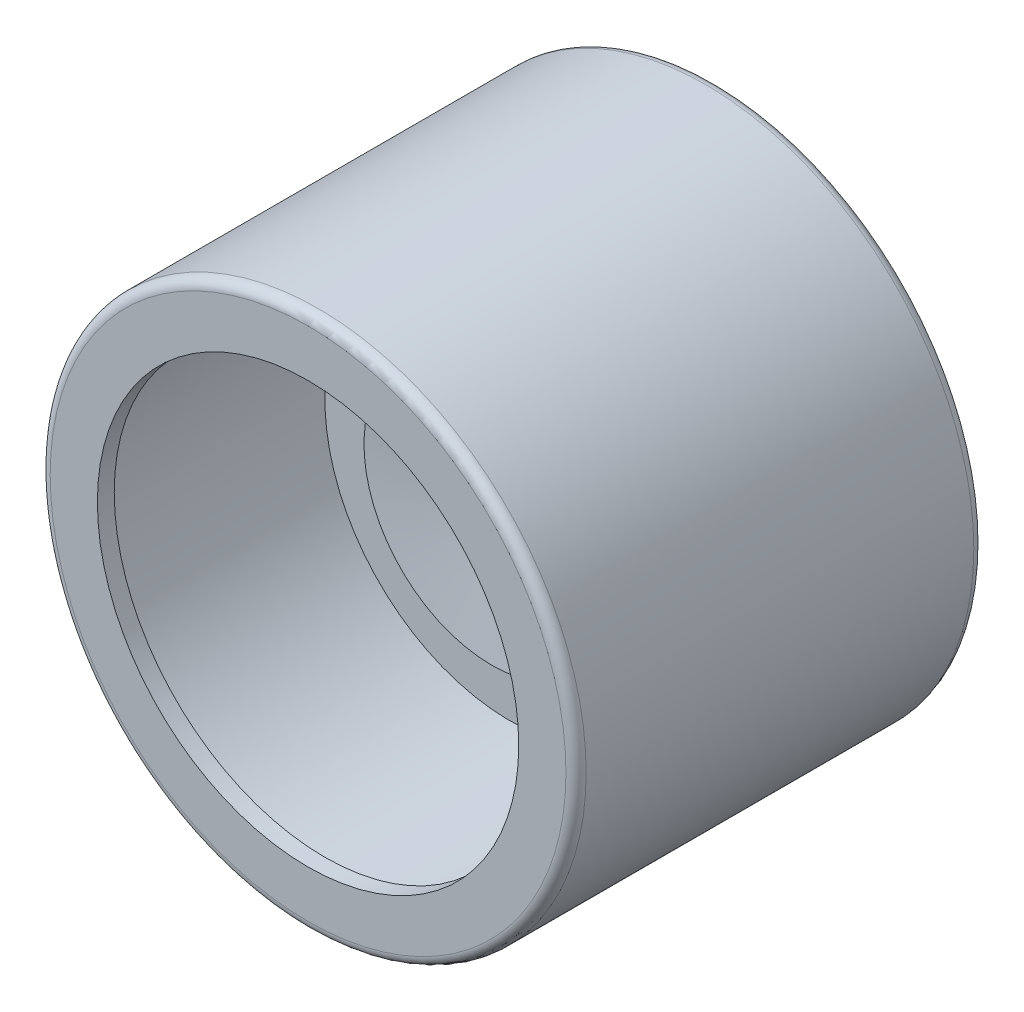
from build123d import *

# Parameters (mm, degrees)
SKETCH1_R           = 7.95
BOSS_EXTRUDE1_DEPTH = 12.1
FILLET1_R           = 0.3
SKETCH3_R           = 7.5
CUT_EXTRUDE2_DEPTH  = 10
SKETCH2_R           = 7.65
SKETCH2_R_2         = 6.25
BOSS_EXTRUDE2_DEPTH = 0.5
SKETCH4_R           = 5.5
BOSS_EXTRUDE3_DEPTH = 4


with BuildPart() as part:
    # Sketch1 → Boss-Extrude1 (new body)
    with BuildSketch(Plane.XY):
        Circle(SKETCH1_R)
    extrude(amount=BOSS_EXTRUDE1_DEPTH)

    # Fillet1
    fillet1_edges = [part.edges().sort_by_distance(p)[0] for p in [
        (-7.95, 0, 0),
        (-7.95, 0, 12.1),
    ]]
    fillet(fillet1_edges, radius=FILLET1_R)

    # Sketch3 → Cut-Extrude2 (cut)
    with BuildSketch(Plane.XY.offset(12.1)):
        Circle(SKETCH3_R)
    extrude(amount=-CUT_EXTRUDE2_DEPTH, mode=Mode.SUBTRACT)

    # Sketch2 → Boss-Extrude2 (add)
    with BuildSketch(Plane.XY.offset(12.1)):
        Circle(SKETCH2_R)
        Circle(SKETCH2_R_2, mode=Mode.SUBTRACT)
    extrude(amount=-BOSS_EXTRUDE2_DEPTH)

    # Sketch4 → Boss-Extrude3 (add)
    with BuildSketch(Plane.XY.offset(2.1)):
        Circle(SKETCH4_R)
    extrude(amount=BOSS_EXTRUDE3_DEPTH)

    # Sketch6 → Revolve2 (revolve)
    with BuildSketch(Plane(origin=(0, 0, 0), x_dir=(0, 0, -1), z_dir=(1, 0, 0))):
        with BuildLine():
            Line((-5.5, 3.790901005), (-5.5, 0))
            Line((-5.5, 0), (-6, 0))
            Line((-6, 0), (-6, 0.25))
            Line((-6, 0.25), (-6.119453289, 0.451240685))
            ThreePointArc((-6.119453289, 0.451240685), (-6.249755753, 0.734093475), (-6.318842572, 1.03775685))
            Line((-6.318842572, 1.03775685), (-6.65, 3.790901005))
            Line((-6.65, 3.790901005), (-5.5, 3.790901005))
        make_face()
    revolve(axis=Axis((0, 0, 0), (0, 0, 1)))


solid = part.part
